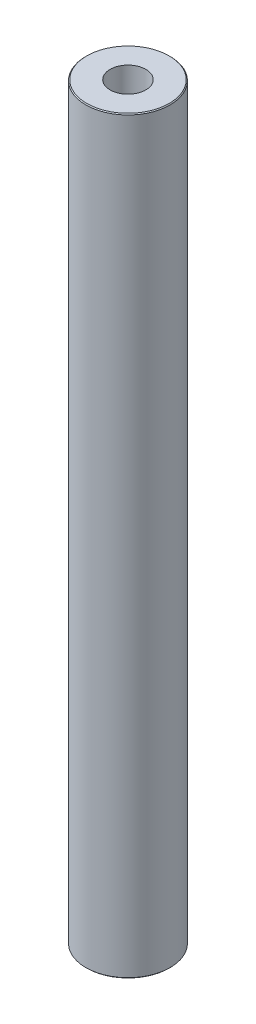
from build123d import *

# Parameters (mm, degrees)
SKETCH1_R           = 20
BOSS_EXTRUDE1_DEPTH = 355.88432975
SKETCH2_R           = 8.489997672
CUT_EXTRUDE1_DEPTH  = 358.006521175
CHAMFER1_SIZE       = 0.419898558


with BuildPart() as part:
    # Sketch1 → Boss-Extrude1 (new body)
    with BuildSketch(Plane(origin=(0, 0, 0), x_dir=(1, 0, 0), z_dir=(0, 1, 0))):
        Circle(SKETCH1_R)
    extrude(amount=BOSS_EXTRUDE1_DEPTH)

    # Sketch2 → Cut-Extrude1 (cut, through all)
    with BuildSketch(Plane(origin=(0, 0, 0), x_dir=(1, 0, 0), z_dir=(0, 1, 0))):
        Circle(SKETCH2_R)
    extrude(amount=CUT_EXTRUDE1_DEPTH, mode=Mode.SUBTRACT)

    # Chamfer1
    chamfer1_edges = [part.edges().sort_by_distance(p)[0] for p in [
        (-20, 355.88432975, 0),
        (-20, 0, 0),
    ]]
    chamfer(chamfer1_edges, length=CHAMFER1_SIZE)


solid = part.part
